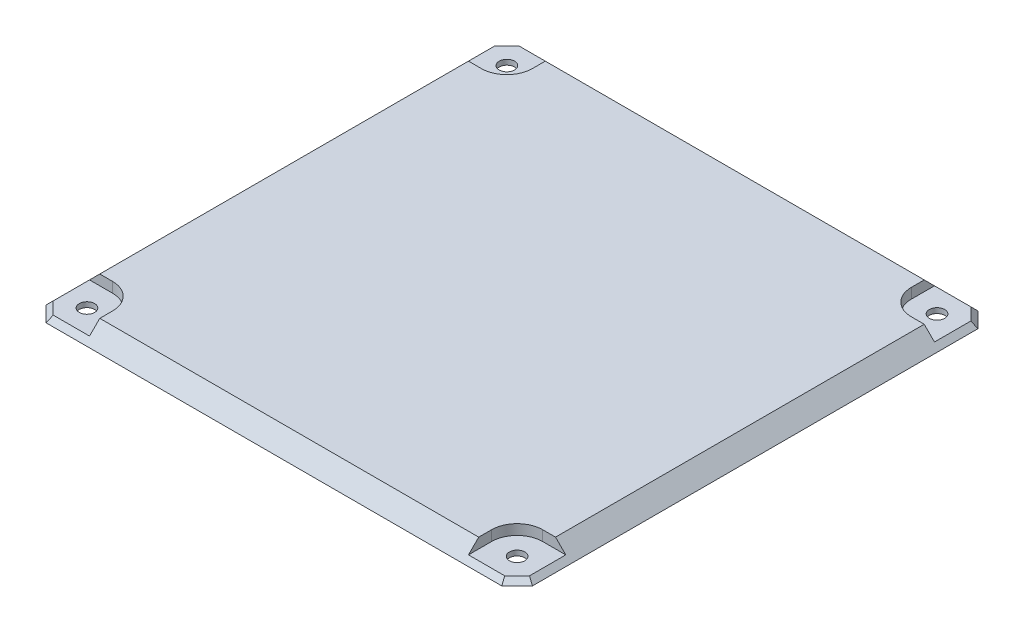
from build123d import *

# Parameters (mm, degrees)
BOSS_EXTRUDE1_DEPTH  = 2
BOSS_EXTRUDE5_DEPTH  = 1
SKETCH8_R            = 1.5
CUT_EXTRUDE1_DEPTH   = 67.539461976
SKETCH9_W            = 10.5
SKETCH9_H            = 10.5
CUT_EXTRUDE2_DEPTH   = 2
FILLET2_R            = 5
FILLET2_OF_MIRROR3_R = 5
MIRROR4_OUTLINE_R    = 1.5
MIRROR4_DEPTH        = 2
CHAMFER2_SIZE        = 1
CHAMFER1_SIZE        = 3
CUT_EXTRUDE3_START   = -0.5
CUT_EXTRUDE3_DEPTH   = 67.039461976
BOSS_EXTRUDE6_DEPTH  = 0.5


# Read off the part's stored shape, not the designer's step: Mirror4
with BuildPart() as part:
    # Sketch1 → Boss-Extrude1 (new body)
    with BuildSketch(Plane(origin=(0, 0, 0), x_dir=(1, 0, 0), z_dir=(0, 1, 0))):
        Polygon((47.5, -43.5), (47.5, 43.5), (44.5, 46.5), (-44.5, 46.5), (-47.5, 43.5), (-47.5, -43.5), (-44.5, -46.5), (44.5, -46.5), align=None)
    extrude(amount=BOSS_EXTRUDE1_DEPTH)

    # Sketch7 → Boss-Extrude5 (add)
    with BuildSketch(Plane.XZ):
        Polygon((44.5, -46.5), (47.5, -43.5), (47.5, 43.5), (44.5, 46.5), (-44.5, 46.5), (-47.5, 43.5), (-47.5, -43.5), (-44.5, -46.5), align=None)
        Polygon((-45.5, -24.5), (-45.5, 24.5), (-25.5, 44.5), (25.5, 44.5), (45.5, 24.5), (45.5, -24.5), (25.5, -44.5), (-25.5, -44.5), align=None, mode=Mode.SUBTRACT)
    extrude(amount=BOSS_EXTRUDE5_DEPTH)

    # Sketch8 → Cut-Extrude1 (cut, through all)
    with BuildSketch(Plane.XZ.offset(1)):
        with Locations(Location((-42, 41, 0), (0, 0, 270))):
            Circle(SKETCH8_R)
        with Locations(Location((42, 41, 0), (0, 0, 270))):
            Circle(SKETCH8_R)
        with Locations(Location((42, -41, 0), (0, 0, 270))):
            Circle(SKETCH8_R)
        with Locations(Location((-42, -41, 0), (0, 0, 270))):
            Circle(SKETCH8_R)
    extrude(amount=-CUT_EXTRUDE1_DEPTH, mode=Mode.SUBTRACT)

    # Sketch9 → Cut-Extrude2 (cut)
    with BuildSketch(Plane(origin=(0, 2, 0), x_dir=(1, 0, 0), z_dir=(0, 1, 0))):
        with Locations((-42.25, 41.25)):
            Rectangle(SKETCH9_W, SKETCH9_H)
    cut_extrude2 = extrude(amount=-CUT_EXTRUDE2_DEPTH, mode=Mode.SUBTRACT)

    # Fillet2
    fillet2_edges = [part.edges().sort_by_distance(p)[0] for p in [
        (-37, 1, -36),
    ]]
    fillet(fillet2_edges, radius=FILLET2_R)

    # Mirror3: Cut-Extrude2 across plane
    add(cut_extrude2.mirror(Plane(origin=(0, 0, 0), x_dir=(0, 0, 1), z_dir=(1, 0, 0))), mode=Mode.SUBTRACT)

    # Fillet2 of Mirror3
    fillet2_of_mirror3_edges = [part.edges().sort_by_distance(p)[0] for p in [
        (37, 1, -36),
    ]]
    fillet(fillet2_of_mirror3_edges, radius=FILLET2_OF_MIRROR3_R)

    # Mirror4 outline → Mirror4 (cut)
    # profile 1 of 2: a face of its own
    with BuildSketch(Plane(origin=(0, 0, 0), x_dir=(1, 0, 0), z_dir=(0, 1, 0))):
        with BuildLine():
            Line((37, -41), (37, -46.5))
            Line((37, -46.5), (44.5, -46.5))
            Line((44.5, -46.5), (47.5, -43.5))
            Line((47.5, -43.5), (47.5, -36))
            Line((47.5, -36), (42, -36))
            ThreePointArc((42, -36), (38.464466094, -37.464466094), (37, -41))
        make_face()
        with Locations((42, -41)):
            Circle(MIRROR4_OUTLINE_R, mode=Mode.SUBTRACT)
    # profile 2 of 2: a face of its own
    with BuildSketch(Plane(origin=(0, 0, 0), x_dir=(1, 0, 0), z_dir=(0, 1, 0))):
        with BuildLine():
            Line((-37, -46.5), (-37, -41))
            ThreePointArc((-37, -41), (-38.464466094, -37.464466094), (-42, -36))
            Line((-42, -36), (-47.5, -36))
            Line((-47.5, -36), (-47.5, -43.5))
            Line((-47.5, -43.5), (-44.5, -46.5))
            Line((-44.5, -46.5), (-37, -46.5))
        make_face()
        with Locations((-42, -41)):
            Circle(MIRROR4_OUTLINE_R, mode=Mode.SUBTRACT)
    extrude(amount=MIRROR4_DEPTH, mode=Mode.SUBTRACT)

    # Chamfer2
    chamfer2_edges = [part.edges().sort_by_distance(p)[0] for p in [
        (-46, 0, 45),
        (46, 0, 45),
        (46, 0, -45),
        (-46, 0, -45),
    ]]
    chamfer(chamfer2_edges, length=CHAMFER2_SIZE - 0.0001)  # a hair under: the kernel refuses the full size

    # Chamfer1
    chamfer1_edges = [part.edges().sort_by_distance(p)[0] for p in [
        (47.5, 2, 0),
        (0, 2, -46.5),
        (-47.5, 2, 0),
        (0, 2, 46.5),
    ]]
    chamfer(chamfer1_edges, length=CHAMFER1_SIZE - 0.0001)  # a hair under: the kernel refuses the full size

    # Sketch11 → Cut-Extrude3 (cut, through all)
    # profile 1 of 5: a face of its own
    with BuildSketch(Plane(origin=(0, 2, 0), x_dir=(1, 0, 0), z_dir=(0, 1, 0)).offset(CUT_EXTRUDE3_START)):
        with BuildLine():
            Line((-2.993140612, 11.609823917), (2.661447725, 11.609823917))
            add(Edge.make_bspline(
                [(2.661447725, 11.609823917), (2.753826707, 11.611776071), (2.933896912, 11.615581316), (3.195625862, 11.650328301), (3.440924642, 11.707868164), (3.668110362, 11.791263919), (3.87988908, 11.89380175), (4.073562729, 12.021947729), (4.249338527, 12.174104626), (4.407913606, 12.348792332), (4.549863591, 12.545630483), (4.670691443, 12.766291094), (4.774675097, 13.00852758), (4.857161795, 13.273890976), (4.925019985, 13.560811829), (4.969145143, 13.870858563), (4.999531837, 14.202372497), (5.003236367, 14.431028545), (5.005145798, 14.548885077)],
                knots=[0, 0, 0, 0, 1.034928103, 2.017338911, 2.952994127, 3.853038192, 4.724242918, 5.58444331, 6.447693392, 7.323153255, 8.223014811, 9.160971226, 10.137008122, 11.172588677, 12.271517983, 13.437861302, 14.679392988, 16, 16, 16, 16], degree=3))
            Line((5.005145798, 14.548885077), (5.006859388, 23.359224244))
            Line((5.006859388, 23.359224244), (-2.993140612, 23.359224244))
            Line((-2.993140612, 23.359224244), (-2.993140612, 20.833873821))
            Line((-2.993140612, 20.833873821), (3.044593562, 20.833873821))
            Line((3.044593562, 20.833873821), (3.044593562, 18.747199292))
            Line((3.044593562, 18.747199292), (-2.993140612, 18.747199292))
            Line((-2.993140612, 18.747199292), (-2.993140612, 16.24556108))
            Line((-2.993140612, 16.24556108), (3.044593562, 16.24556108))
            Line((3.044593562, 16.24556108), (3.044593562, 15.071806657))
            add(Edge.make_bspline(
                [(3.044593562, 15.071806657), (3.040714914, 15.000818284), (3.033322128, 14.865512946), (2.993920271, 14.673744126), (2.922192721, 14.507567483), (2.825732628, 14.366066065), (2.704012402, 14.25259732), (2.559909534, 14.169824506), (2.39460014, 14.12159896), (2.278186934, 14.11381315), (2.217838765, 14.109777015)],
                knots=[0, 0, 0, 0, 1.19415961, 2.276093407, 3.270406576, 4.216705333, 5.134670092, 6.042926015, 6.985460194, 8, 8, 8, 8], degree=3))
            Line((2.217838765, 14.109777015), (-2.993140612, 14.11146213))
            Line((-2.993140612, 14.11146213), (-2.993140612, 11.609823917))
        make_face()
    # profile 2 of 5: a face of its own
    with BuildSketch(Plane(origin=(0, 2, 0), x_dir=(1, 0, 0), z_dir=(0, 1, 0)).offset(CUT_EXTRUDE3_START)):
        with BuildLine():
            add(Edge.make_bspline(
                [(-2.993138937, 5.897576517), (-2.991593261, 5.762393842), (-2.988596471, 5.500298648), (-2.953407487, 5.121392409), (-2.898490371, 4.769490356), (-2.817356768, 4.445422743), (-2.715677612, 4.147075951), (-2.58877981, 3.876511497), (-2.438297413, 3.633303118), (-2.264499616, 3.416920199), (-2.064276708, 3.227928976), (-1.839814147, 3.063784889), (-1.589254267, 2.926444756), (-1.314294176, 2.81536465), (-1.015157387, 2.727164042), (-0.690426131, 2.666912194), (-0.341020192, 2.630762625), (-0.100148015, 2.626535645), (0.024013722, 2.624356775)],
                knots=[0, 0, 0, 0, 1.264098041, 2.450861568, 3.556059647, 4.592449321, 5.571738732, 6.499987297, 7.381518289, 8.240985537, 9.088387607, 9.949500598, 10.835174967, 11.753837337, 12.718427414, 13.747394228, 14.838855326, 16, 16, 16, 16], degree=3))
            add(Edge.make_bspline(
                [(0.024013722, 2.624356775), (0.147600843, 2.626551583), (0.387326722, 2.630808922), (0.734510279, 2.666670781), (1.057377856, 2.727637172), (1.355441258, 2.815380518), (1.630049626, 2.926063957), (1.879370365, 3.06377138), (2.102178198, 3.228464079), (2.30228373, 3.416860744), (2.476011868, 3.633321561), (2.626553287, 3.87649842), (2.753275057, 4.147111295), (2.855604783, 4.44515456), (2.933898369, 4.76978309), (2.989615621, 5.121345958), (3.024550277, 5.500147868), (3.027591731, 5.762070079), (3.02915952, 5.897084048)],
                knots=[0, 0, 0, 0, 1.158186699, 2.246571676, 3.267136807, 4.233719281, 5.154279183, 6.037094379, 6.895664914, 7.744817325, 8.606059835, 9.489411662, 10.419577559, 11.400889729, 12.438133347, 13.545614255, 14.734829086, 16, 16, 16, 16], degree=3))
            Line((3.02915952, 5.897084048), (3.030873111, 7.628567887))
            add(Edge.make_bspline(
                [(3.030873111, 7.628567887), (3.028592403, 7.763890556), (3.024173098, 8.026104083), (2.989589138, 8.405794119), (2.933859815, 8.758506564), (2.855777185, 9.084301846), (2.75381008, 9.382616378), (2.625462815, 9.652321383), (2.477184222, 9.896375076), (2.301615037, 10.1115118), (2.102191833, 10.299745598), (1.879892644, 10.464985632), (1.629082394, 10.599590217), (1.356267644, 10.714045364), (1.056953366, 10.79819074), (0.734585443, 10.860049476), (0.387335193, 10.896140128), (0.147598225, 10.899026602), (0.024013722, 10.90051458)],
                knots=[0, 0, 0, 0, 1.26769055, 2.456392651, 3.568684506, 4.61068505, 5.591574127, 6.516496223, 7.404021586, 8.260732698, 9.109518996, 9.967719358, 10.847564872, 11.769768271, 12.734432948, 13.754558062, 14.842473782, 16, 16, 16, 16], degree=3))
            add(Edge.make_bspline(
                [(0.024013722, 10.90051458), (-0.100145332, 10.899042356), (-0.341028401, 10.89618607), (-0.690501932, 10.859809497), (-1.014730099, 10.798654526), (-1.315119155, 10.714059119), (-1.588289323, 10.599205964), (-1.840335375, 10.46497672), (-2.064291532, 10.300281373), (-2.263831024, 10.111452571), (-2.439469866, 9.896393582), (-2.587689076, 9.652308377), (-2.71621238, 9.382651147), (-2.817525159, 9.084035403), (-2.898478057, 8.758798699), (-2.953277894, 8.405745261), (-2.988654906, 8.025884885), (-2.991611678, 7.763379115), (-2.993138937, 7.627787307)],
                knots=[0, 0, 0, 0, 1.160429975, 2.251369709, 3.27984501, 4.242476435, 5.162736078, 6.045417472, 6.90611913, 7.753116416, 8.608021813, 9.493676512, 10.416649122, 11.395470751, 12.436552129, 13.546499574, 14.732696212, 16, 16, 16, 16], degree=3))
            Line((-2.993138937, 7.627787307), (-2.993138937, 5.897576517))
        make_face()
        with BuildLine():
            add(Edge.make_bspline(
                [(-1.140651801, 7.201748097), (-1.13938704, 7.263204152), (-1.136961565, 7.381060518), (-1.11730923, 7.549114214), (-1.090098695, 7.700982372), (-1.055502598, 7.837974531), (-1.007117004, 7.957891777), (-0.951103733, 8.062719477), (-0.883244559, 8.150359496), (-0.77923797, 8.243937259), (-0.628841166, 8.33174352), (-0.430165152, 8.407254005), (-0.209089774, 8.446420315), (-0.055594124, 8.446123212), (0.024013722, 8.445969125)],
                knots=[0, 0, 0, 0, 1.116668216, 2.14147261, 3.070955002, 3.920427669, 4.703899179, 5.415499754, 6.074466061, 6.707094748, 7.947527221, 9.213680472, 10.554923887, 12, 12, 12, 12], degree=3))
            add(Edge.make_bspline(
                [(0.024013722, 8.445969125), (0.102482125, 8.446140141), (0.253716653, 8.446469744), (0.471930883, 8.407021022), (0.668227045, 8.331605781), (0.817523581, 8.244392597), (0.919277843, 8.149763601), (0.987199325, 8.062797422), (1.043106941, 7.957867111), (1.091565274, 7.837985222), (1.125967894, 7.700965611), (1.153960293, 7.549237278), (1.170250445, 7.380537052), (1.174466399, 7.262466281), (1.176672384, 7.200686106)],
                knots=[0, 0, 0, 0, 1.431661465, 2.759284488, 4.022212845, 5.260141476, 5.888357472, 6.550729177, 7.266007152, 8.053527476, 8.907390036, 9.841675796, 10.870663369, 12, 12, 12, 12], degree=3))
            Line((1.176672384, 7.200686106), (1.178385975, 6.407389044))
            add(Edge.make_bspline(
                [(1.178385975, 6.407389044), (1.175458236, 6.340754162), (1.169883508, 6.213874191), (1.154108221, 6.032856529), (1.126016929, 5.870852383), (1.091824912, 5.725262374), (1.042991367, 5.598091776), (0.987539484, 5.486809692), (0.920364338, 5.394378735), (0.817448857, 5.297437413), (0.668937736, 5.206643676), (0.472000727, 5.130197912), (0.25394225, 5.087752017), (0.102518397, 5.089831169), (0.024013722, 5.090909091)],
                knots=[0, 0, 0, 0, 1.179416097, 2.245734887, 3.209712096, 4.085060225, 4.884939085, 5.61290565, 6.278149703, 6.893097025, 8.101911108, 9.3278521, 10.614642948, 12, 12, 12, 12], degree=3))
            add(Edge.make_bspline(
                [(0.024013722, 5.090909091), (-0.055629794, 5.089848247), (-0.209311831, 5.087801216), (-0.430236866, 5.129956432), (-0.629550118, 5.206504149), (-0.779152072, 5.297891249), (-0.884356795, 5.393771355), (-0.951438326, 5.486891491), (-1.007004093, 5.598065875), (-1.05575752, 5.725273442), (-1.09016763, 5.870835591), (-1.117364838, 6.032975779), (-1.137018046, 6.213378553), (-1.13940291, 6.340137605), (-1.140651801, 6.40651801)],
                knots=[0, 0, 0, 0, 1.398530562, 2.698638094, 3.927816791, 5.139084209, 5.75826623, 6.420177815, 7.144497711, 7.940369665, 8.811332833, 9.770481103, 10.832459186, 12, 12, 12, 12], degree=3))
            Line((-1.140651801, 6.40651801), (-1.140651801, 7.201748097))
        make_face(mode=Mode.SUBTRACT)
    # profile 3 of 5: a face of its own
    with BuildSketch(Plane(origin=(0, 2, 0), x_dir=(1, 0, 0), z_dir=(0, 1, 0)).offset(CUT_EXTRUDE3_START)):
        with BuildLine():
            Line((-2.993140612, -3.836145208), (3.030874786, -6.610473842))
            Line((3.030874786, -6.610473842), (3.030874786, -4.013986787))
            Line((3.030874786, -4.013986787), (0.499941373, -2.875800681))
            add(Edge.make_bspline(
                [(0.499941373, -2.875800681), (0.399670932, -2.831315113), (0.209293524, -2.746853062), (-0.062673168, -2.628435976), (-0.304861447, -2.522983302), (-0.521745577, -2.435597621), (-0.713203379, -2.358366422), (-0.885242057, -2.295653669), (-1.036535395, -2.240988801), (-1.132503484, -2.213388861), (-1.176672384, -2.200686106)],
                knots=[0, 0, 0, 0, 1.455589859, 2.763640238, 3.936176174, 4.960433838, 5.86632832, 6.675283895, 7.390305104, 8, 8, 8, 8], degree=3))
            Line((-1.176672384, -2.200686106), (-1.175312232, -2.140722154))
            add(Edge.make_bspline(
                [(-1.175312232, -2.140722154), (-1.131627892, -2.129080481), (-1.036221089, -2.103655014), (-0.884503049, -2.053532951), (-0.713711054, -1.989078406), (-0.521207684, -1.915116967), (-0.305645777, -1.826195692), (-0.062815922, -1.725174124), (0.208993778, -1.611926547), (0.399132598, -1.531273104), (0.499142367, -1.488850772)],
                knots=[0, 0, 0, 0, 0.603307338, 1.317626049, 2.131302103, 3.039698341, 4.06993283, 5.243370594, 6.550060044, 8, 8, 8, 8], degree=3))
            Line((0.499142367, -1.488850772), (3.030874786, -0.409730784))
            Line((3.030874786, -0.409730784), (3.030874786, 2.269749008))
            Line((3.030874786, 2.269749008), (-2.993140612, -0.397874678))
            Line((-2.993140612, -0.397874678), (-2.993140612, -3.836145208))
        make_face()
    # profile 4 of 5: a face of its own
    with BuildSketch(Plane(origin=(0, 2, 0), x_dir=(1, 0, 0), z_dir=(0, 1, 0)).offset(CUT_EXTRUDE3_START)):
        with BuildLine():
            Line((-2.993138937, -14.438434686), (-1.469982847, -14.438434686))
            Line((-1.469982847, -14.438434686), (-1.469982847, -10.502207735))
            add(Edge.make_bspline(
                [(-1.469982847, -10.502207735), (-1.46832022, -10.41810291), (-1.465219611, -10.261257), (-1.426652172, -10.043988868), (-1.361387739, -9.862451439), (-1.263815933, -9.716275332), (-1.133985699, -9.604952118), (-0.976497931, -9.520750276), (-0.78845877, -9.462154339), (-0.652224001, -9.44487077), (-0.579759863, -9.43567753)],
                knots=[0, 0, 0, 0, 1.277732666, 2.38282573, 3.340436924, 4.191726913, 5.02356834, 5.914561034, 6.890741783, 8, 8, 8, 8], degree=3))
            Line((-0.579759863, -9.43567753), (-0.578046272, -13.169831422))
            add(Edge.make_bspline(
                [(-0.578046272, -13.169831422), (-0.578284368, -13.23335729), (-0.578747011, -13.356794383), (-0.556660885, -13.535120028), (-0.524029646, -13.701349321), (-0.481161703, -13.856409461), (-0.419799983, -13.997753541), (-0.347408341, -14.128046953), (-0.262017367, -14.247022753), (-0.161024495, -14.352468826), (-0.046739823, -14.446339372), (0.082895448, -14.526432398), (0.22616966, -14.596174453), (0.385751132, -14.649630528), (0.558566352, -14.694992328), (0.747031998, -14.724720595), (0.949287515, -14.743887851), (1.089146334, -14.746506279), (1.161234991, -14.747855918)],
                knots=[0, 0, 0, 0, 1.128104803, 2.192020044, 3.186546858, 4.138575601, 5.044637778, 5.918201493, 6.78416576, 7.639570555, 8.506190517, 9.405674712, 10.342007044, 11.331901955, 12.391781028, 13.514498924, 14.7188764, 16, 16, 16, 16], degree=3))
            add(Edge.make_bspline(
                [(1.161234991, -14.747855918), (1.232180535, -14.747275837), (1.370967126, -14.746141059), (1.57300364, -14.725435014), (1.763018833, -14.689527583), (1.941104102, -14.638662953), (2.106400717, -14.569338642), (2.259973201, -14.485648057), (2.400594572, -14.384334123), (2.529814695, -14.268290374), (2.645096771, -14.131872488), (2.744392787, -13.974765238), (2.828527375, -13.796639402), (2.896260341, -13.59782911), (2.9514981, -13.378804734), (2.989776889, -13.138311096), (3.014055069, -12.876996301), (3.017225491, -12.69588356), (3.018867925, -12.602058319)],
                knots=[0, 0, 0, 0, 1.042407244, 2.039199948, 2.980341081, 3.881927717, 4.755949004, 5.609777407, 6.44702504, 7.297828833, 8.156523805, 9.063421748, 10.021999443, 11.0452595, 12.145933517, 13.338272575, 14.621095259, 16, 16, 16, 16], degree=3))
            Line((3.018867925, -12.602058319), (3.020581515, -9.790841418))
            add(Edge.make_bspline(
                [(3.020581515, -9.790841418), (3.019655599, -9.663842041), (3.017868598, -9.41873576), (2.993383332, -9.066071992), (2.945913444, -8.743014322), (2.876726856, -8.45028764), (2.784226239, -8.187119429), (2.670089433, -7.954227559), (2.533162631, -7.751632895), (2.3727129, -7.57811601), (2.183747432, -7.431468022), (1.966378017, -7.30590808), (1.716379908, -7.204356691), (1.437375111, -7.120183284), (1.12652173, -7.05827562), (0.785084465, -7.013573258), (0.411935691, -6.992550201), (0.153248859, -6.992937661), (0.018867925, -6.993138937)],
                knots=[0, 0, 0, 0, 1.258396768, 2.428680835, 3.500032431, 4.490868068, 5.404832769, 6.25876339, 7.053962379, 7.819709927, 8.590471974, 9.415549799, 10.299444184, 11.258403516, 12.299605236, 13.436720094, 14.668444213, 16, 16, 16, 16], degree=3))
            add(Edge.make_bspline(
                [(0.018867925, -6.993138937), (-0.117823347, -6.993892379), (-0.381224224, -6.995344244), (-0.760086858, -7.022051945), (-1.106398181, -7.071220459), (-1.420381366, -7.14105236), (-1.70339774, -7.23053518), (-1.95369416, -7.343386287), (-2.172024848, -7.478015464), (-2.358264562, -7.636410455), (-2.51765526, -7.818580184), (-2.651512961, -8.02733001), (-2.765400249, -8.261352332), (-2.853121113, -8.524244707), (-2.924010382, -8.811396529), (-2.968320245, -9.126857993), (-2.994906707, -9.467794347), (-2.993741756, -9.704349508), (-2.993138937, -9.826758148)],
                knots=[0, 0, 0, 0, 1.350278417, 2.601954884, 3.749142547, 4.803008632, 5.776605991, 6.676557218, 7.50886608, 8.302331768, 9.082965266, 9.891450314, 10.745389055, 11.647535979, 12.624405394, 13.663758671, 14.791080597, 16, 16, 16, 16], degree=3))
            Line((-2.993138937, -9.826758148), (-2.993138937, -14.438434686))
        make_face()
        with BuildLine():
            add(Edge.make_bspline(
                [(1.518008617, -11.79452321), (1.516919405, -11.836820999), (1.514884957, -11.915825479), (1.49434242, -12.025684097), (1.460983399, -12.119314851), (1.410130028, -12.195215297), (1.344756827, -12.253920751), (1.264385549, -12.294256098), (1.169291522, -12.316455451), (1.101321951, -12.317022608), (1.065180103, -12.317324185)],
                knots=[0, 0, 0, 0, 1.270663288, 2.373365042, 3.347375387, 4.239149479, 5.091600922, 5.960539658, 6.915546086, 8, 8, 8, 8], degree=3))
            add(Edge.make_bspline(
                [(1.065180103, -12.317324185), (1.029040384, -12.316986588), (0.960517458, -12.316346484), (0.86436302, -12.29418288), (0.78258436, -12.25436944), (0.716613638, -12.195670784), (0.668084335, -12.118703641), (0.633851636, -12.025961321), (0.615471334, -11.916100263), (0.615672957, -11.837687157), (0.615780446, -11.795883362)],
                knots=[0, 0, 0, 0, 1.083849903, 2.055039921, 2.938830956, 3.790807608, 4.672591545, 5.646059393, 6.745061204, 8, 8, 8, 8], degree=3))
            Line((0.615780446, -11.795883362), (0.615780446, -9.43515826))
            add(Edge.make_bspline(
                [(0.615780446, -9.43515826), (0.688686883, -9.440493089), (0.826542935, -9.450580516), (1.017141445, -9.499320014), (1.176557305, -9.576111789), (1.309189119, -9.679421472), (1.406269437, -9.824178639), (1.47371048, -10.004635878), (1.511414947, -10.224306292), (1.514587907, -10.382926557), (1.516295026, -10.468267581)],
                knots=[0, 0, 0, 0, 1.110998818, 2.100746043, 2.972353025, 3.788988663, 4.626491954, 5.587839498, 6.702207136, 8, 8, 8, 8], degree=3))
            Line((1.516295026, -10.468267581), (1.518008617, -11.79452321))
        make_face(mode=Mode.SUBTRACT)
    # profile 5 of 5: a face of its own
    with BuildSketch(Plane(origin=(0, 2, 0), x_dir=(1, 0, 0), z_dir=(0, 1, 0)).offset(CUT_EXTRUDE3_START)):
        with BuildLine():
            add(Edge.make_bspline(
                [(-2.993138937, -20.229353157), (-2.991593261, -20.364535832), (-2.988596471, -20.626631026), (-2.953407487, -21.005537265), (-2.898490371, -21.357439318), (-2.817356768, -21.681506931), (-2.715677612, -21.979853723), (-2.58877981, -22.250418177), (-2.438297413, -22.493626556), (-2.264499616, -22.710009475), (-2.064276708, -22.899000698), (-1.839814147, -23.063144785), (-1.589254267, -23.200484919), (-1.314294176, -23.311565024), (-1.015157387, -23.399765632), (-0.690426131, -23.46001748), (-0.341020192, -23.496167049), (-0.100148015, -23.500394029), (0.024013722, -23.502572899)],
                knots=[0, 0, 0, 0, 1.264098041, 2.450861568, 3.556059647, 4.592449321, 5.571738732, 6.499987297, 7.381518289, 8.240985537, 9.088387607, 9.949500598, 10.835174967, 11.753837337, 12.718427414, 13.747394228, 14.838855326, 16, 16, 16, 16], degree=3))
            add(Edge.make_bspline(
                [(0.024013722, -23.502572899), (0.147600843, -23.500378091), (0.387326722, -23.496120752), (0.734510279, -23.460258893), (1.057377856, -23.399292502), (1.355441258, -23.311549156), (1.630049626, -23.200865718), (1.879370365, -23.063158294), (2.102178198, -22.898465595), (2.30228373, -22.71006893), (2.476011868, -22.493608113), (2.626553287, -22.250431254), (2.753275057, -21.979818379), (2.855604783, -21.681775114), (2.933898369, -21.357146584), (2.989615621, -21.005583716), (3.024550277, -20.626781806), (3.027591731, -20.364859595), (3.02915952, -20.229845626)],
                knots=[0, 0, 0, 0, 1.158186699, 2.246571676, 3.267136807, 4.233719281, 5.154279183, 6.037094379, 6.895664914, 7.744817325, 8.606059835, 9.489411662, 10.419577559, 11.400889729, 12.438133347, 13.545614255, 14.734829086, 16, 16, 16, 16], degree=3))
            Line((3.02915952, -20.229845626), (3.030873111, -18.498361787))
            add(Edge.make_bspline(
                [(3.030873111, -18.498361787), (3.028592403, -18.363039118), (3.024173098, -18.100825591), (2.989589138, -17.721135555), (2.933859815, -17.36842311), (2.855777185, -17.042627828), (2.75381008, -16.744313296), (2.625462815, -16.474608292), (2.477184222, -16.230554598), (2.301615037, -16.015417874), (2.102191833, -15.827184076), (1.879892644, -15.661944042), (1.629082394, -15.527339457), (1.356267644, -15.41288431), (1.056953366, -15.328738934), (0.734585443, -15.266880198), (0.387335193, -15.230789546), (0.147598225, -15.227903072), (0.024013722, -15.226415094)],
                knots=[0, 0, 0, 0, 1.26769055, 2.456392651, 3.568684506, 4.61068505, 5.591574127, 6.516496223, 7.404021586, 8.260732698, 9.109518996, 9.967719358, 10.847564872, 11.769768271, 12.734432948, 13.754558062, 14.842473782, 16, 16, 16, 16], degree=3))
            add(Edge.make_bspline(
                [(0.024013722, -15.226415094), (-0.100145332, -15.227887318), (-0.341028401, -15.230743604), (-0.690501932, -15.267120177), (-1.014730099, -15.328275148), (-1.315119155, -15.412870555), (-1.588289323, -15.52772371), (-1.840335375, -15.661952954), (-2.064291532, -15.826648301), (-2.263831024, -16.015477103), (-2.439469866, -16.230536092), (-2.587689076, -16.474621297), (-2.71621238, -16.744278527), (-2.817525159, -17.042894271), (-2.898478057, -17.368130975), (-2.953277894, -17.721184413), (-2.988654906, -18.101044789), (-2.991611678, -18.36355056), (-2.993138937, -18.499142367)],
                knots=[0, 0, 0, 0, 1.160429975, 2.251369709, 3.27984501, 4.242476435, 5.162736078, 6.045417472, 6.90611913, 7.753116416, 8.608021813, 9.493676512, 10.416649122, 11.395470751, 12.436552129, 13.546499574, 14.732696212, 16, 16, 16, 16], degree=3))
            Line((-2.993138937, -18.499142367), (-2.993138937, -20.229353157))
        make_face()
        with BuildLine():
            add(Edge.make_bspline(
                [(-1.140651801, -18.925181577), (-1.13938704, -18.863725522), (-1.136961565, -18.745869156), (-1.11730923, -18.57781546), (-1.090098695, -18.425947302), (-1.055502598, -18.288955143), (-1.007117004, -18.169037897), (-0.951103733, -18.064210197), (-0.883244559, -17.976570178), (-0.77923797, -17.882992415), (-0.628841166, -17.795186154), (-0.430165152, -17.719675669), (-0.209089774, -17.680509359), (-0.055594124, -17.680806462), (0.024013722, -17.680960549)],
                knots=[0, 0, 0, 0, 1.116668216, 2.14147261, 3.070955002, 3.920427669, 4.703899179, 5.415499754, 6.074466061, 6.707094748, 7.947527221, 9.213680472, 10.554923887, 12, 12, 12, 12], degree=3))
            add(Edge.make_bspline(
                [(0.024013722, -17.680960549), (0.102482125, -17.680789534), (0.253716653, -17.680459931), (0.471930883, -17.719908652), (0.668227045, -17.795323893), (0.817523581, -17.882537077), (0.919277843, -17.977166073), (0.987199325, -18.064132252), (1.043106941, -18.169062563), (1.091565274, -18.288944452), (1.125967894, -18.425964063), (1.153960293, -18.577692396), (1.170250445, -18.746392622), (1.174466399, -18.864463393), (1.176672384, -18.926243568)],
                knots=[0, 0, 0, 0, 1.431661465, 2.759284488, 4.022212845, 5.260141476, 5.888357472, 6.550729177, 7.266007152, 8.053527476, 8.907390036, 9.841675796, 10.870663369, 12, 12, 12, 12], degree=3))
            Line((1.176672384, -18.926243568), (1.178385975, -19.71954063))
            add(Edge.make_bspline(
                [(1.178385975, -19.71954063), (1.175458236, -19.786175512), (1.169883508, -19.913055483), (1.154108221, -20.094073145), (1.126016929, -20.256077291), (1.091824912, -20.4016673), (1.042991367, -20.528837898), (0.987539484, -20.640119982), (0.920364338, -20.732550939), (0.817448857, -20.829492261), (0.668937736, -20.920285998), (0.472000727, -20.996731762), (0.25394225, -21.039177658), (0.102518397, -21.037098506), (0.024013722, -21.036020583)],
                knots=[0, 0, 0, 0, 1.179416097, 2.245734887, 3.209712096, 4.085060225, 4.884939085, 5.61290565, 6.278149703, 6.893097025, 8.101911108, 9.3278521, 10.614642948, 12, 12, 12, 12], degree=3))
            add(Edge.make_bspline(
                [(0.024013722, -21.036020583), (-0.055629794, -21.037081427), (-0.209311831, -21.039128458), (-0.430236866, -20.996973242), (-0.629550118, -20.920425525), (-0.779152072, -20.829038425), (-0.884356795, -20.733158319), (-0.951438326, -20.640038183), (-1.007004093, -20.528863799), (-1.05575752, -20.401656232), (-1.09016763, -20.256094084), (-1.117364838, -20.093953895), (-1.137018046, -19.913551121), (-1.13940291, -19.786792069), (-1.140651801, -19.720411664)],
                knots=[0, 0, 0, 0, 1.398530562, 2.698638094, 3.927816791, 5.139084209, 5.75826623, 6.420177815, 7.144497711, 7.940369665, 8.811332833, 9.770481103, 10.832459186, 12, 12, 12, 12], degree=3))
            Line((-1.140651801, -19.720411664), (-1.140651801, -18.925181577))
        make_face(mode=Mode.SUBTRACT)
    extrude(amount=-CUT_EXTRUDE3_DEPTH, mode=Mode.SUBTRACT)


with BuildPart() as body_2:
    # Sketch12 → Boss-Extrude6 (new body)
    with BuildSketch(Plane.XZ):
        Polygon((25.5, -44.5), (45.5, -24.5), (45.5, 24.5), (25.5, 44.5), (-25.5, 44.5), (-45.5, 24.5), (-45.5, -24.5), (-25.5, -44.5), align=None)
        with BuildLine():
            Line((-2.993138937, 20.229353157), (-2.993138937, 18.499142367))
            add(Edge.make_bspline(
                [(-2.993138937, 18.499142367), (-2.991611678, 18.36355056), (-2.988654906, 18.101044789), (-2.953277894, 17.721184413), (-2.898478057, 17.368130975), (-2.817525159, 17.042894271), (-2.71621238, 16.744278527), (-2.587689076, 16.474621297), (-2.439469866, 16.230536092), (-2.263831024, 16.015477103), (-2.064291532, 15.826648301), (-1.840335375, 15.661952954), (-1.588289323, 15.52772371), (-1.315119155, 15.412870555), (-1.014730099, 15.328275148), (-0.690501932, 15.267120177), (-0.341028401, 15.230743604), (-0.100145332, 15.227887318), (0.024013722, 15.226415094)],
                knots=[0, 0, 0, 0, 0.079206487, 0.153343777, 0.222715492, 0.287783078, 0.34895943, 0.406645218, 0.461998637, 0.515430224, 0.568367554, 0.622161408, 0.677328995, 0.734845223, 0.795009687, 0.859289393, 0.927473127, 1, 1, 1, 1], degree=3))
            add(Edge.make_bspline(
                [(0.024013722, 15.226415094), (0.147598225, 15.227903072), (0.387335193, 15.230789546), (0.734585443, 15.266880198), (1.056953366, 15.328738934), (1.356267644, 15.41288431), (1.629082394, 15.527339457), (1.879892644, 15.661944042), (2.102191833, 15.827184076), (2.301615037, 16.015417874), (2.477184222, 16.230554598), (2.625462815, 16.474608292), (2.75381008, 16.744313296), (2.855777185, 17.042627828), (2.933859815, 17.36842311), (2.989589138, 17.721135555), (3.024173098, 18.100825591), (3.028592403, 18.363039118), (3.030873111, 18.498361787)],
                knots=[0, 0, 0, 0, 0.072345389, 0.140340121, 0.204097941, 0.264389483, 0.322027195, 0.37701754, 0.430655063, 0.483704206, 0.537248651, 0.592718986, 0.650526617, 0.711832184, 0.776957218, 0.846475459, 0.920769341, 1, 1, 1, 1], degree=3))
            Line((3.030873111, 18.498361787), (3.02915952, 20.229845626))
            add(Edge.make_bspline(
                [(3.02915952, 20.229845626), (3.027591731, 20.364859595), (3.024550277, 20.626781806), (2.989615621, 21.005583716), (2.933898369, 21.357146584), (2.855604783, 21.681775114), (2.753275057, 21.979818379), (2.626553287, 22.250431254), (2.476011868, 22.493608113), (2.30228373, 22.71006893), (2.102178198, 22.898465595), (1.879370365, 23.063158294), (1.630049626, 23.200865718), (1.355441258, 23.311549156), (1.057377856, 23.399292502), (0.734510279, 23.460258893), (0.387326722, 23.496120752), (0.147600843, 23.500378091), (0.024013722, 23.502572899)],
                knots=[0, 0, 0, 0, 0.079073182, 0.153399109, 0.222616666, 0.287444392, 0.348776403, 0.406911771, 0.46212126, 0.515948917, 0.569020943, 0.622681601, 0.677857551, 0.735392545, 0.79580395, 0.85958927, 0.927613331, 1, 1, 1, 1], degree=3))
            add(Edge.make_bspline(
                [(0.024013722, 23.502572899), (-0.100148015, 23.500394029), (-0.341020192, 23.496167049), (-0.690426131, 23.46001748), (-1.015157387, 23.399765632), (-1.314294176, 23.311565024), (-1.589254267, 23.200484919), (-1.839814147, 23.063144785), (-2.064276708, 22.899000698), (-2.264499616, 22.710009475), (-2.438297413, 22.493626556), (-2.58877981, 22.250418177), (-2.715677612, 21.979853723), (-2.817356768, 21.681506931), (-2.898490371, 21.357439318), (-2.953407487, 21.005537265), (-2.988596471, 20.626631026), (-2.991593261, 20.364535832), (-2.993138937, 20.229353157)],
                knots=[0, 0, 0, 0, 0.072571542, 0.140787861, 0.205098287, 0.265385166, 0.322801565, 0.378156213, 0.431975775, 0.484938404, 0.538655107, 0.593750794, 0.651766329, 0.712971917, 0.777746272, 0.846821152, 0.920993872, 1, 1, 1, 1], degree=3))
        make_face(mode=Mode.SUBTRACT)
        with BuildLine():
            Line((-2.993138937, 14.438434686), (-2.993138937, 9.826758148))
            add(Edge.make_bspline(
                [(-2.993138937, 9.826758148), (-2.993741756, 9.704349508), (-2.994906707, 9.467794347), (-2.968320245, 9.126857993), (-2.924010382, 8.811396529), (-2.853121113, 8.524244707), (-2.765400249, 8.261352332), (-2.651512961, 8.02733001), (-2.51765526, 7.818580184), (-2.358264562, 7.636410455), (-2.172024848, 7.478015464), (-1.95369416, 7.343386287), (-1.70339774, 7.23053518), (-1.420381366, 7.14105236), (-1.106398181, 7.071220459), (-0.760086858, 7.022051945), (-0.381224224, 6.995344244), (-0.117823347, 6.993892379), (0.018867925, 6.993138937)],
                knots=[0, 0, 0, 0, 0.075557463, 0.146015083, 0.210974663, 0.272029001, 0.328413184, 0.381784355, 0.432314671, 0.481104264, 0.53069587, 0.582715174, 0.638962126, 0.699811961, 0.765678591, 0.83737782, 0.915607599, 1, 1, 1, 1], degree=3))
            add(Edge.make_bspline(
                [(0.018867925, 6.993138937), (0.153248859, 6.992937661), (0.411935691, 6.992550201), (0.785084465, 7.013573258), (1.12652173, 7.05827562), (1.437375111, 7.120183284), (1.716379908, 7.204356691), (1.966378017, 7.30590808), (2.183747432, 7.431468022), (2.3727129, 7.57811601), (2.533162631, 7.751632895), (2.670089433, 7.954227559), (2.784226239, 8.187119429), (2.876726856, 8.45028764), (2.945913444, 8.743014322), (2.993383332, 9.066071992), (3.017868598, 9.41873576), (3.019655599, 9.663842041), (3.020581515, 9.790841418)],
                knots=[0, 0, 0, 0, 0.083222237, 0.160204994, 0.231274673, 0.29634978, 0.356284739, 0.411528138, 0.463095502, 0.51126813, 0.559127351, 0.608827288, 0.662197952, 0.719320746, 0.781247973, 0.848207448, 0.921350202, 1, 1, 1, 1], degree=3))
            Line((3.020581515, 9.790841418), (3.018867925, 12.602058319))
            add(Edge.make_bspline(
                [(3.018867925, 12.602058319), (3.017225491, 12.69588356), (3.014055069, 12.876996301), (2.989776889, 13.138311096), (2.9514981, 13.378804734), (2.896260341, 13.59782911), (2.828527375, 13.796639402), (2.744392787, 13.974765238), (2.645096771, 14.131872488), (2.529814695, 14.268290374), (2.400594572, 14.384334123), (2.259973201, 14.485648057), (2.106400717, 14.569338642), (1.941104102, 14.638662953), (1.763018833, 14.689527583), (1.57300364, 14.725435014), (1.370967126, 14.746141059), (1.232180535, 14.747275837), (1.161234991, 14.747855918)],
                knots=[0, 0, 0, 0, 0.086181546, 0.166357964, 0.240879155, 0.309671281, 0.373625035, 0.433536141, 0.490217262, 0.543885698, 0.597060935, 0.649388912, 0.702753187, 0.757379518, 0.813728682, 0.872550003, 0.934849547, 1, 1, 1, 1], degree=3))
            add(Edge.make_bspline(
                [(1.161234991, 14.747855918), (1.089146334, 14.746506279), (0.949287515, 14.743887851), (0.747031998, 14.724720595), (0.558566352, 14.694992328), (0.385751132, 14.649630528), (0.22616966, 14.596174453), (0.082895448, 14.526432398), (-0.046739823, 14.446339372), (-0.161024495, 14.352468826), (-0.262017367, 14.247022753), (-0.347408341, 14.128046953), (-0.419799983, 13.997753541), (-0.481161703, 13.856409461), (-0.524029646, 13.701349321), (-0.556660885, 13.535120028), (-0.578747011, 13.356794383), (-0.578284368, 13.23335729), (-0.578046272, 13.169831422)],
                knots=[0, 0, 0, 0, 0.080070225, 0.155343817, 0.225513686, 0.291756128, 0.35362456, 0.41214533, 0.468363093, 0.52252684, 0.57598964, 0.630112407, 0.684710139, 0.741339025, 0.800840821, 0.862998747, 0.92949345, 1, 1, 1, 1], degree=3))
            Line((-0.578046272, 13.169831422), (-0.579759863, 9.43567753))
            add(Edge.make_bspline(
                [(-0.579759863, 9.43567753), (-0.652224001, 9.44487077), (-0.78845877, 9.462154339), (-0.976497931, 9.520750276), (-1.133985699, 9.604952118), (-1.263815933, 9.716275332), (-1.361387739, 9.862451439), (-1.426652172, 10.043988868), (-1.465219611, 10.261257), (-1.46832022, 10.41810291), (-1.469982847, 10.502207735)],
                knots=[0, 0, 0, 0, 0.138657277, 0.260679871, 0.372053958, 0.476034136, 0.582445384, 0.702146784, 0.840283417, 1, 1, 1, 1], degree=3))
            Line((-1.469982847, 10.502207735), (-1.469982847, 14.438434686))
            Line((-1.469982847, 14.438434686), (-2.993138937, 14.438434686))
        make_face(mode=Mode.SUBTRACT)
        with BuildLine():
            Line((-2.993138937, -5.897576517), (-2.993138937, -7.627787307))
            add(Edge.make_bspline(
                [(-2.993138937, -7.627787307), (-2.991611678, -7.763379115), (-2.988654906, -8.025884885), (-2.953277894, -8.405745261), (-2.898478057, -8.758798699), (-2.817525159, -9.084035403), (-2.71621238, -9.382651147), (-2.587689076, -9.652308377), (-2.439469866, -9.896393582), (-2.263831024, -10.111452571), (-2.064291532, -10.300281373), (-1.840335375, -10.46497672), (-1.588289323, -10.599205964), (-1.315119155, -10.714059119), (-1.014730099, -10.798654526), (-0.690501932, -10.859809497), (-0.341028401, -10.89618607), (-0.100145332, -10.899042356), (0.024013722, -10.90051458)],
                knots=[0, 0, 0, 0, 0.079206487, 0.153343777, 0.222715492, 0.287783078, 0.34895943, 0.406645218, 0.461998637, 0.515430224, 0.568367554, 0.622161408, 0.677328995, 0.734845223, 0.795009687, 0.859289393, 0.927473127, 1, 1, 1, 1], degree=3))
            add(Edge.make_bspline(
                [(0.024013722, -10.90051458), (0.147598225, -10.899026602), (0.387335193, -10.896140128), (0.734585443, -10.860049476), (1.056953366, -10.79819074), (1.356267644, -10.714045364), (1.629082394, -10.599590217), (1.879892644, -10.464985632), (2.102191833, -10.299745598), (2.301615037, -10.1115118), (2.477184222, -9.896375076), (2.625462815, -9.652321383), (2.75381008, -9.382616378), (2.855777185, -9.084301846), (2.933859815, -8.758506564), (2.989589138, -8.405794119), (3.024173098, -8.026104083), (3.028592403, -7.763890556), (3.030873111, -7.628567887)],
                knots=[0, 0, 0, 0, 0.072345389, 0.140340121, 0.204097941, 0.264389483, 0.322027195, 0.37701754, 0.430655063, 0.483704206, 0.537248651, 0.592718986, 0.650526617, 0.711832184, 0.776957218, 0.846475459, 0.920769341, 1, 1, 1, 1], degree=3))
            Line((3.030873111, -7.628567887), (3.02915952, -5.897084048))
            add(Edge.make_bspline(
                [(3.02915952, -5.897084048), (3.027591731, -5.762070079), (3.024550277, -5.500147868), (2.989615621, -5.121345958), (2.933898369, -4.76978309), (2.855604783, -4.44515456), (2.753275057, -4.147111295), (2.626553287, -3.87649842), (2.476011868, -3.633321561), (2.30228373, -3.416860744), (2.102178198, -3.228464079), (1.879370365, -3.06377138), (1.630049626, -2.926063957), (1.355441258, -2.815380518), (1.057377856, -2.727637172), (0.734510279, -2.666670781), (0.387326722, -2.630808922), (0.147600843, -2.626551583), (0.024013722, -2.624356775)],
                knots=[0, 0, 0, 0, 0.079073182, 0.153399109, 0.222616666, 0.287444392, 0.348776403, 0.406911771, 0.46212126, 0.515948917, 0.569020943, 0.622681601, 0.677857551, 0.735392545, 0.79580395, 0.85958927, 0.927613331, 1, 1, 1, 1], degree=3))
            add(Edge.make_bspline(
                [(0.024013722, -2.624356775), (-0.100148015, -2.626535645), (-0.341020192, -2.630762625), (-0.690426131, -2.666912194), (-1.015157387, -2.727164042), (-1.314294176, -2.81536465), (-1.589254267, -2.926444756), (-1.839814147, -3.063784889), (-2.064276708, -3.227928976), (-2.264499616, -3.416920199), (-2.438297413, -3.633303118), (-2.58877981, -3.876511497), (-2.715677612, -4.147075951), (-2.817356768, -4.445422743), (-2.898490371, -4.769490356), (-2.953407487, -5.121392409), (-2.988596471, -5.500298648), (-2.991593261, -5.762393842), (-2.993138937, -5.897576517)],
                knots=[0, 0, 0, 0, 0.072571542, 0.140787861, 0.205098287, 0.265385166, 0.322801565, 0.378156213, 0.431975775, 0.484938404, 0.538655107, 0.593750794, 0.651766329, 0.712971917, 0.777746272, 0.846821152, 0.920993872, 1, 1, 1, 1], degree=3))
        make_face(mode=Mode.SUBTRACT)
        with BuildLine():
            Line((-2.993140612, 0.397874678), (3.030874786, -2.269749008))
            Line((3.030874786, -2.269749008), (3.030874786, 0.409730784))
            Line((3.030874786, 0.409730784), (0.499142367, 1.488850772))
            add(Edge.make_bspline(
                [(0.499142367, 1.488850772), (0.399132598, 1.531273104), (0.208993778, 1.611926547), (-0.062815922, 1.725174124), (-0.305645777, 1.826195692), (-0.521207684, 1.915116967), (-0.713711054, 1.989078406), (-0.884503049, 2.053532951), (-1.036221089, 2.103655014), (-1.131627892, 2.129080481), (-1.175312232, 2.140722154)],
                knots=[0, 0, 0, 0, 0.181242494, 0.344578676, 0.491258396, 0.620037707, 0.733587237, 0.835296744, 0.924586583, 1, 1, 1, 1], degree=3))
            Line((-1.175312232, 2.140722154), (-1.176672384, 2.200686106))
            add(Edge.make_bspline(
                [(-1.176672384, 2.200686106), (-1.132503484, 2.213388861), (-1.036535395, 2.240988801), (-0.885242057, 2.295653669), (-0.713203379, 2.358366422), (-0.521745577, 2.435597621), (-0.304861447, 2.522983302), (-0.062673168, 2.628435976), (0.209293524, 2.746853062), (0.399670932, 2.831315113), (0.499941373, 2.875800681)],
                knots=[0, 0, 0, 0, 0.076211862, 0.165589513, 0.26670896, 0.37994577, 0.507977978, 0.65454497, 0.818051268, 1, 1, 1, 1], degree=3))
            Line((0.499941373, 2.875800681), (3.030874786, 4.013986787))
            Line((3.030874786, 4.013986787), (3.030874786, 6.610473842))
            Line((3.030874786, 6.610473842), (-2.993140612, 3.836145208))
            Line((-2.993140612, 3.836145208), (-2.993140612, 0.397874678))
        make_face(mode=Mode.SUBTRACT)
        with BuildLine():
            Line((-2.993140612, -14.11146213), (2.217838765, -14.109777015))
            add(Edge.make_bspline(
                [(2.217838765, -14.109777015), (2.278186934, -14.11381315), (2.39460014, -14.12159896), (2.559909534, -14.169824506), (2.704012402, -14.25259732), (2.825732628, -14.366066065), (2.922192721, -14.507567483), (2.993920271, -14.673744126), (3.033322128, -14.865512946), (3.040714914, -15.000818284), (3.044593562, -15.071806657)],
                knots=[0, 0, 0, 0, 0.126817476, 0.244634248, 0.358166239, 0.472911833, 0.591199178, 0.715488324, 0.850730049, 1, 1, 1, 1], degree=3))
            Line((3.044593562, -15.071806657), (3.044593562, -16.24556108))
            Line((3.044593562, -16.24556108), (-2.993140612, -16.24556108))
            Line((-2.993140612, -16.24556108), (-2.993140612, -18.747199292))
            Line((-2.993140612, -18.747199292), (3.044593562, -18.747199292))
            Line((3.044593562, -18.747199292), (3.044593562, -20.833873821))
            Line((3.044593562, -20.833873821), (-2.993140612, -20.833873821))
            Line((-2.993140612, -20.833873821), (-2.993140612, -23.359224244))
            Line((-2.993140612, -23.359224244), (5.006859388, -23.359224244))
            Line((5.006859388, -23.359224244), (5.005145798, -14.548885077))
            add(Edge.make_bspline(
                [(5.005145798, -14.548885077), (5.003236367, -14.431028545), (4.999531837, -14.202372497), (4.969145143, -13.870858563), (4.925019985, -13.560811829), (4.857161795, -13.273890976), (4.774675097, -13.00852758), (4.670691443, -12.766291094), (4.549863591, -12.545630483), (4.407913606, -12.348792332), (4.249338527, -12.174104626), (4.073562729, -12.021947729), (3.87988908, -11.89380175), (3.668110362, -11.791263919), (3.440924642, -11.707868164), (3.195625862, -11.650328301), (2.933896912, -11.615581316), (2.753826707, -11.611776071), (2.661447725, -11.609823917)],
                knots=[0, 0, 0, 0, 0.082537938, 0.160133669, 0.233030126, 0.301713208, 0.366436992, 0.427439298, 0.486061574, 0.542302922, 0.597019163, 0.650972293, 0.704734818, 0.759185113, 0.815437867, 0.873916318, 0.935316994, 1, 1, 1, 1], degree=3))
            Line((2.661447725, -11.609823917), (-2.993140612, -11.609823917))
            Line((-2.993140612, -11.609823917), (-2.993140612, -14.11146213))
        make_face(mode=Mode.SUBTRACT)
    extrude(amount=BOSS_EXTRUDE6_DEPTH)


solid = Compound([part.part, body_2.part])
